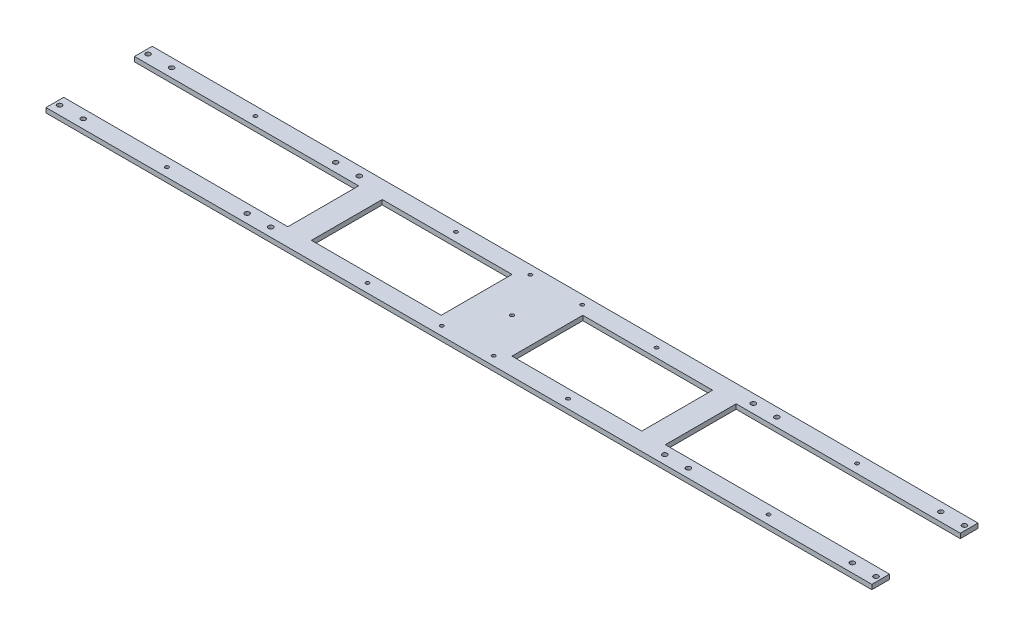
from build123d import *

# Parameters (mm, degrees)
SKETCH_1_W                                 = 700
SKETCH_1_H                                 = 90
SKETCH_1_W_2                               = 280
SKETCH_1_H_2                               = 60
EXTRUDE_1_DEPTH                            = 4
SKETCH_2_W                                 = 190
SKETCH_2_H                                 = 60
CUT_EXTRUDE_1_DEPTH                        = 4
SKETCH_4_R                                 = 2
CUT_EXTRUDE_2_DEPTH                        = 15
MIRROR_2_AT_THE_SECOND_PLANE_COPY_1_SKET_R = 2
MIRROR_2_AT_THE_SECOND_PLANE_COPY_1_DEPTH  = 15
SKETCH_5_W                                 = 60
SKETCH_5_H                                 = 60
EXTRUDE_2_DEPTH                            = 4
SKETCH_6_R                                 = 1.5
CUT_EXTRUDE_3_DEPTH                        = 4
MIRROR_3_AT_THE_SECOND_PLANE_COPY_1_SKET_R = 1.5
MIRROR_3_AT_THE_SECOND_PLANE_COPY_1_DEPTH  = 4


with BuildPart() as part:
    # 草图1 → 凸台-拉伸1 (new body)
    with BuildSketch(Plane(origin=(0, 0, 0), x_dir=(1, 0, 0), z_dir=(0, 1, 0))):
        Rectangle(SKETCH_1_W, SKETCH_1_H)
        Rectangle(SKETCH_1_W_2, SKETCH_1_H_2, mode=Mode.SUBTRACT)
    extrude(amount=EXTRUDE_1_DEPTH)

    # 草图2 → 切除-拉伸1 (cut)
    with BuildSketch(Plane(origin=(0, 4, 0), x_dir=(1, 0, 0), z_dir=(0, 1, 0))):
        with Locations((-255, 0)):
            Rectangle(SKETCH_2_W, SKETCH_2_H)
    cut_extrude_1 = extrude(amount=-CUT_EXTRUDE_1_DEPTH, mode=Mode.SUBTRACT)

    # 镜向1: 切除-拉伸1 across plane
    add(cut_extrude_1.mirror(Plane(origin=(0, 0, 0), x_dir=(0, 0, 1), z_dir=(1, 0, 0))), mode=Mode.SUBTRACT)

    # 草图4 → 切除-拉伸2 (cut)
    with BuildSketch(Plane(origin=(0, 4, 0), x_dir=(1, 0, 0), z_dir=(0, 1, 0))):
        with Locations((-187, 37.5)):
            Circle(SKETCH_4_R)
        with Locations((-167, 37.5)):
            Circle(SKETCH_4_R)
        with Locations((-346, 37.5)):
            Circle(SKETCH_4_R)
        with Locations((-326, 37.5)):
            Circle(SKETCH_4_R)
    cut_extrude_2 = extrude(amount=-CUT_EXTRUDE_2_DEPTH, mode=Mode.SUBTRACT)

    # 镜向2: 切除-拉伸2 across plane
    add(cut_extrude_2.mirror(Plane(origin=(0, 0, 0), x_dir=(0, 0, 1), z_dir=(1, 0, 0))), mode=Mode.SUBTRACT)

    # 镜向2 at the second plane: 切除-拉伸2 across plane
    add(cut_extrude_2.mirror(Plane.XY), mode=Mode.SUBTRACT)

    # 镜向2 at the second plane copy 1 sket → 镜向2 at the second plane copy 1 (cut)
    with BuildSketch(Plane(origin=(0, 4, 0), x_dir=(-1, 0, 0), z_dir=(0, 1, 0))):
        with Locations((-187, 37.5)):
            Circle(MIRROR_2_AT_THE_SECOND_PLANE_COPY_1_SKET_R)
        with Locations((-167, 37.5)):
            Circle(MIRROR_2_AT_THE_SECOND_PLANE_COPY_1_SKET_R)
        with Locations((-346, 37.5)):
            Circle(MIRROR_2_AT_THE_SECOND_PLANE_COPY_1_SKET_R)
        with Locations((-326, 37.5)):
            Circle(MIRROR_2_AT_THE_SECOND_PLANE_COPY_1_SKET_R)
    extrude(amount=-MIRROR_2_AT_THE_SECOND_PLANE_COPY_1_DEPTH, mode=Mode.SUBTRACT)

    # 草图5 → 凸台-拉伸2 (add)
    with BuildSketch(Plane(origin=(0, 4, 0), x_dir=(1, 0, 0), z_dir=(0, 1, 0))):
        Rectangle(SKETCH_5_W, SKETCH_5_H)
    extrude(amount=-EXTRUDE_2_DEPTH)

    # 草图6 → 切除-拉伸3 (cut)
    with BuildSketch(Plane(origin=(0, 4, 0), x_dir=(1, 0, 0), z_dir=(0, 1, 0))):
        with Locations((-255, 37.5)):
            Circle(SKETCH_6_R)
        with Locations((-85, 37.5)):
            Circle(SKETCH_6_R)
        Circle(SKETCH_6_R)
        with Locations((-22, 37.5)):
            Circle(SKETCH_6_R)
    cut_extrude_3 = extrude(amount=-CUT_EXTRUDE_3_DEPTH, mode=Mode.SUBTRACT)

    # 镜向3: 切除-拉伸3 across plane
    add(cut_extrude_3.mirror(Plane.XY), mode=Mode.SUBTRACT)

    # 镜向3 at the second plane: 切除-拉伸3 across plane
    add(cut_extrude_3.mirror(Plane(origin=(0, 0, 0), x_dir=(0, 0, 1), z_dir=(1, 0, 0))), mode=Mode.SUBTRACT)

    # 镜向3 at the second plane copy 1 sket → 镜向3 at the second plane copy 1 (cut)
    with BuildSketch(Plane(origin=(0, 4, 0), x_dir=(-1, 0, 0), z_dir=(0, 1, 0))):
        with Locations((-255, 37.5)):
            Circle(MIRROR_3_AT_THE_SECOND_PLANE_COPY_1_SKET_R)
        with Locations((-85, 37.5)):
            Circle(MIRROR_3_AT_THE_SECOND_PLANE_COPY_1_SKET_R)
        Circle(MIRROR_3_AT_THE_SECOND_PLANE_COPY_1_SKET_R)
        with Locations((-22, 37.5)):
            Circle(MIRROR_3_AT_THE_SECOND_PLANE_COPY_1_SKET_R)
    extrude(amount=-MIRROR_3_AT_THE_SECOND_PLANE_COPY_1_DEPTH, mode=Mode.SUBTRACT)


solid = part.part
